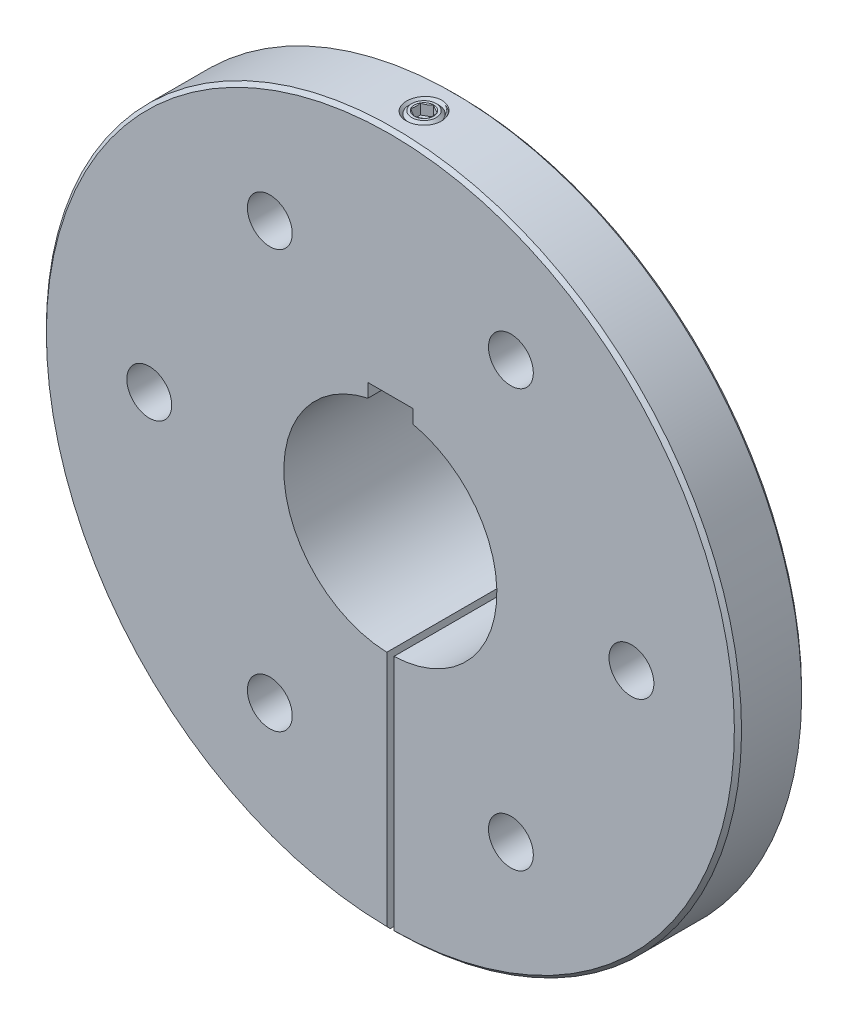
from build123d import *

# Parameters (mm, degrees)
SKETCH3_W           = 1.016
SKETCH3_H           = 49.2125
CUT_EXTRUDE1_DEPTH  = 75.646268954
SKETCH16_W          = 6.35
SKETCH16_H          = 3.175
CUT_EXTRUDE7_DEPTH  = 75.646268954
CUT_EXTRUDE9_REACH  = 115.301
SKETCH19_R          = 1.725592336
CUT_SWEEP2_PITCH    = 1.058333333
CUT_EXTRUDE11_DEPTH = 1.48828125
SKETCH24_R          = 3.175
CUT_EXTRUDE13_DEPTH = 75.646269086
CIRPATTERN1_COUNT   = 6


with BuildPart() as part:
    # Sketch1 → Revolve1 (revolve)
    with BuildSketch(Plane(origin=(0, 0, 0), x_dir=(0, 0, -1), z_dir=(1, 0, 0)), mode=Mode.PRIVATE) as revolve1_sk:
        Polygon((26.9875, -17.016015625), (12.7, -17.4625), (12.7, -16.66875), (9.525, -16.66875), (9.525, -48.7045), (9.017, -49.2125), (0.508, -49.2125), (0, -48.7045), (0, -15.08125), (26.9875, -15.08125), align=None)
    revolve(revolve1_sk.sketch.rotate(Axis((0, 0, 0), (0, 0, -1)), 270), axis=Axis((0, 0, 0), (0, 0, -1)))

    # Sketch3 → Cut-Extrude1 (cut, through all)
    with BuildSketch(Plane.XY):
        with Locations((0, -24.60625)):
            Rectangle(SKETCH3_W, SKETCH3_H)
    extrude(amount=-CUT_EXTRUDE1_DEPTH, mode=Mode.SUBTRACT)

    # Sketch16 → Cut-Extrude7 (cut, through all)
    with BuildSketch(Plane.XY):
        with Locations((0, 15.08125)):
            Rectangle(SKETCH16_W, SKETCH16_H)
    extrude(amount=-CUT_EXTRUDE7_DEPTH, mode=Mode.SUBTRACT)

    # Sketch19 → Cut-Extrude9 (cut, up to next)
    with BuildSketch(Plane(origin=(0, 49.2125, 0), x_dir=(-1, 0, 0), z_dir=(0, 1, 0)), mode=Mode.PRIVATE) as cut_extrude9_sk1:
        with Locations(Location((0, -4.7625, 0), (0, 0, 90))):
            Circle(SKETCH19_R)
    cut_extrude9_tool1 = extrude(cut_extrude9_sk1.sketch, amount=-CUT_EXTRUDE9_REACH, mode=Mode.PRIVATE) & part.part
    add(cut_extrude9_tool1.solids().sort_by_distance((0, 49.2125, -4.7625))[0], mode=Mode.SUBTRACT)

    # Cut-Sweep2: arcs per turn and ends read off the stored shape
    # Cut-Sweep2: the profile of Sketch18 screwed along a right-hand helix through 46.5 turns, 8 arcs to a turn; built about Z, then put on its axis
    cut_sweep2_z = Axis((0, 0, 0), (0, 0, 1))
    cut_sweep2_corners = [(1.668308364, 0, -1.025260417), (1.668308364, 0, -0.033072917), (2.413, 0, -0.463020833), (2.413, 0, -0.5953125)]
    with BuildLine(mode=Mode.PRIVATE) as cut_sweep2_profile:
        Line(cut_sweep2_corners[0], cut_sweep2_corners[1])
        Line(cut_sweep2_corners[1], cut_sweep2_corners[2])
        Line(cut_sweep2_corners[2], cut_sweep2_corners[3])
        Line(cut_sweep2_corners[3], cut_sweep2_corners[0])
    cut_sweep2_cap = Face(cut_sweep2_profile.wire())
    cut_sweep2_turn_angles = [0, 22.5, 45, 67.5, 90, 112.5, 135, 157.5, 180, 202.5, 225, 247.5, 270, 292.5, 315, 337.5, 360]
    cut_sweep2_turn_weights = [1, 0.9238795325112867, 1, 0.9238795325112867, 1, 0.9238795325112867, 1, 0.9238795325112867, 1, 0.9238795325112867, 1, 0.9238795325112867, 1, 0.9238795325112867, 1, 0.9238795325112867, 1]
    cut_sweep2_turn_rails = [Edge.make_bspline([Vector(p[0], p[1], 0).rotate(cut_sweep2_z, cut_sweep2_turn_angles[k]) / cut_sweep2_turn_weights[k] + Vector(0, 0, p[2] + CUT_SWEEP2_PITCH * cut_sweep2_turn_angles[k] / 360) for k in range(17)], [0, 0, 0, 1, 1, 2, 2, 3, 3, 4, 4, 5, 5, 6, 6, 7, 7, 8, 8, 8], 2, cut_sweep2_turn_weights) for p in cut_sweep2_corners]
    cut_sweep2_turn_sides = [Face.make_surface_from_curves(cut_sweep2_turn_rails[p[0]], cut_sweep2_turn_rails[p[1]]) for p in [(0, 1), (1, 2), (2, 3), (3, 0)]]
    cut_sweep2_last_angles = [16560, 16582.5, 16605, 16627.5, 16650, 16672.5, 16695, 16717.5, 16740]
    cut_sweep2_last_weights = [1, 0.9238795325112867, 1, 0.9238795325112867, 1, 0.9238795325112867, 1, 0.923879532511469, 1]
    cut_sweep2_last_rails = [Edge.make_bspline([Vector(p[0], p[1], 0).rotate(cut_sweep2_z, cut_sweep2_last_angles[k]) / cut_sweep2_last_weights[k] + Vector(0, 0, p[2] + CUT_SWEEP2_PITCH * cut_sweep2_last_angles[k] / 360) for k in range(9)], [0, 0, 0, 1, 1, 2, 2, 3, 3, 4, 4, 4], 2, cut_sweep2_last_weights) for p in cut_sweep2_corners]
    cut_sweep2_last_sides = [Face.make_surface_from_curves(cut_sweep2_last_rails[p[0]], cut_sweep2_last_rails[p[1]]) for p in [(0, 1), (1, 2), (2, 3), (3, 0)]]
    cut_sweep2 = Plane(origin=(0, 49.2125, -4.7625), x_dir=(0, 0, 1), z_dir=(0, -1, 0)) * Solid(Shell([*[p.moved(Location((0, 0, CUT_SWEEP2_PITCH * i))) for i in range(46) for p in cut_sweep2_turn_sides], *cut_sweep2_last_sides, cut_sweep2_cap, cut_sweep2_cap.rotate(cut_sweep2_z, 16740).moved(Location((0, 0, CUT_SWEEP2_PITCH * 16740 / 360)))]))
    add(cut_sweep2, mode=Mode.SUBTRACT)

    # Cut-Extrude10 cone 1 section (through the dimple's axis) → Cut-Extrude10 (revolve, cut)
    with BuildSketch(Plane(origin=(0, 49.2125, -4.7625), x_dir=(0, 0, 1), z_dir=(1, 0, 0))):
        Polygon((0, 0), (2.527567944, 0), (0, 2.527567944), align=None)
    revolve(axis=Axis((0, 49.2125, -4.7625), (0, -1, 0)), mode=Mode.SUBTRACT)

    # Sketch24 → Cut-Extrude13 (cut, through all)
    with BuildSketch(Plane.XY):
        with Locations((-34.13125, 0)):
            Circle(SKETCH24_R)
    cut_extrude13 = extrude(amount=-CUT_EXTRUDE13_DEPTH, mode=Mode.SUBTRACT)

    # CirPattern1: Cut-Extrude13 ×6 about axis
    cirpattern1_axis = Axis((0, 0, 0), (0, 0, 1))
    for i in range(1, CIRPATTERN1_COUNT):
        add(cut_extrude13.rotate(cirpattern1_axis, i * 360 / CIRPATTERN1_COUNT), mode=Mode.SUBTRACT)


with BuildPart() as body_2:
    # Sketch21 → Revolve2 (revolve)
    with BuildSketch(Plane(origin=(0, 0, 0), x_dir=(0, 0, -1), z_dir=(1, 0, 0)), mode=Mode.PRIVATE) as revolve2_sk:
        Polygon((3.036907664, 49.2125), (4.7625, 49.2125), (4.7625, 16.66875), (3.036907664, 16.66875), (2.3495, 17.356157664), (2.3495, 48.525092336), align=None)
    revolve(revolve2_sk.sketch.rotate(Axis((0, 16.66875, -4.7625), (0, 1, 0)), 180), axis=Axis((0, 16.66875, -4.7625), (0, 1, 0)))

    # Sketch22 → Cut-Extrude11 (cut)
    with BuildSketch(Plane(origin=(0, 49.2125, 0), x_dir=(1, 0, 0), z_dir=(0, 1, 0))):
        Polygon((0, 6.137315329), (-1.190625, 5.449907664), (-1.190625, 4.075092336), (0, 3.387684671), (1.190625, 4.075092336), (1.190625, 5.449907664), align=None)
    extrude(amount=-CUT_EXTRUDE11_DEPTH, mode=Mode.SUBTRACT)

    # Cut-Extrude12 cone 1 section (through the dimple's axis) → Cut-Extrude12 (revolve, cut)
    with BuildSketch(Plane(origin=(0, 49.2125, -4.7625), x_dir=(0, 0, 1), z_dir=(1, 0, 0))):
        Polygon((0, 0), (1.374815329, 0), (0, 0.79375), align=None)
    revolve(axis=Axis((0, 49.2125, -4.7625), (0, -1, 0)), mode=Mode.SUBTRACT)


solid = Compound([part.part, body_2.part])
